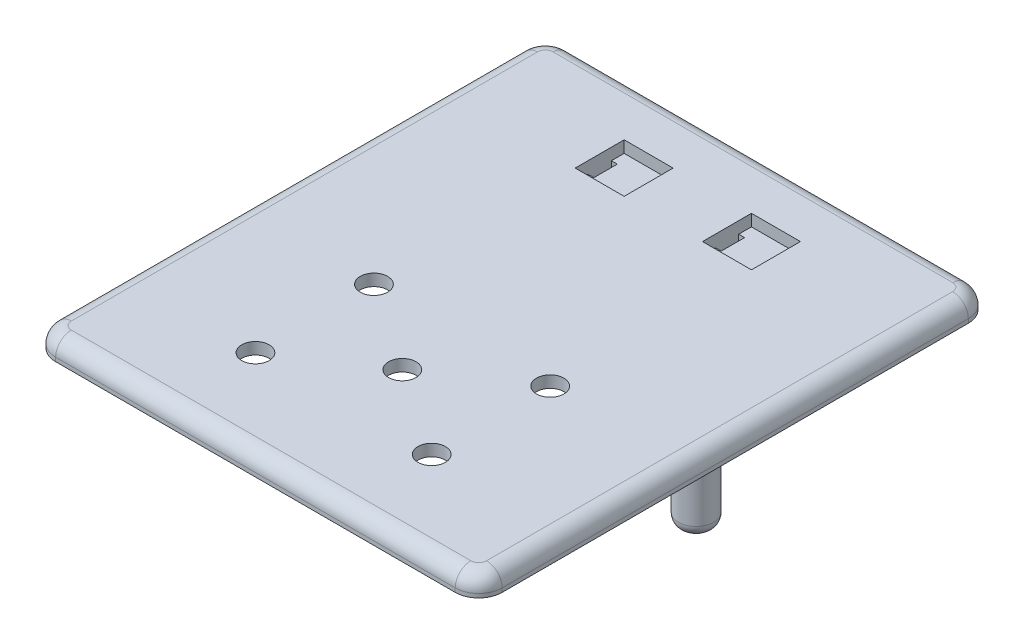
from build123d import *

# Parameters (mm, degrees)
SKETCH1_W             = 114
SKETCH1_H             = 131
BOSS_EXTRUDE1_DEPTH   = 5
SKETCH3_W             = 104
SKETCH3_H             = 121
CUT_EXTRUDE2_DEPTH    = 2
FILLET1_R             = 6
FILLET2_R             = 4
FILLET3_R             = 6
SKETCH5_R             = 7.5
BOSS_EXTRUDE2_DEPTH   = 2
FILLET4_R             = 6
FILLET7_R             = 6
SKETCH15_R            = 4.5
BOSS_EXTRUDE4_DEPTH   = 20
FILLET8_R             = 3
SKETCH10_R            = 3.5
CUT_EXTRUDE3_DEPTH    = 90.102469102
SKETCH11_W            = 22.5
SKETCH11_H            = 22.5
SKETCH11_W_2          = 12.5
SKETCH11_H_2          = 12.5
BOSS_EXTRUDE3_DEPTH   = 8
CUT_EXTRUDE5_START    = -3
SKETCH13_W            = 12.5
SKETCH13_H            = 12.5
CUT_EXTRUDE5_DEPTH    = 94.356239408
SKETCH14_W            = 1.5
SKETCH14_H            = 6
CUT_EXTRUDE6_DEPTH    = 90.572596256
FILLET10_R            = 5
FILLET10_OF_MIRROR1_R = 5
CUT_EXTRUDE7_DEPTH    = 1


with BuildPart() as part:
    # Sketch1 → Boss-Extrude1 (new body)
    with BuildSketch(Plane(origin=(0, 0, 0), x_dir=(1, 0, 0), z_dir=(0, 1, 0))):
        Rectangle(SKETCH1_W, SKETCH1_H)
    extrude(amount=BOSS_EXTRUDE1_DEPTH)

    # Sketch3 → Cut-Extrude2 (cut)
    with BuildSketch(Plane.XZ):
        Rectangle(SKETCH3_W, SKETCH3_H)
    extrude(amount=-CUT_EXTRUDE2_DEPTH, mode=Mode.SUBTRACT)

    # Fillet1
    fillet1_edges = [part.edges().sort_by_distance(p)[0] for p in [
        (57, 2.5, 65.5),
        (-57, 2.5, 65.5),
        (-57, 2.5, -65.5),
        (57, 2.5, -65.5),
    ]]
    fillet(fillet1_edges, radius=FILLET1_R)

    # Fillet2
    fillet2_edges = [part.edges().sort_by_distance(p)[0] for p in [
        (0, 5, 65.5),
        (-57, 5, 0),
        (57, 5, 0),
        (0, 5, -65.5),
        (55.242640687, 5, 63.742640687),
        (55.242640687, 5, -63.742640687),
        (-55.242640687, 5, -63.742640687),
        (-55.242640687, 5, 63.742640687),
    ]]
    fillet(fillet2_edges, radius=FILLET2_R)

    # Fillet3
    fillet3_edges = [part.edges().sort_by_distance(p)[0] for p in [
        (52, 1, -60.5),
        (-52, 1, -60.5),
        (-52, 1, 60.5),
        (52, 1, 60.5),
    ]]
    fillet(fillet3_edges, radius=FILLET3_R)

    # Sketch5 → Boss-Extrude2 (add)
    with BuildSketch(Plane.XZ):
        with Locations((-47, 0)):
            Circle(SKETCH5_R)
        with Locations((47, 0)):
            Circle(SKETCH5_R)
    extrude(amount=-BOSS_EXTRUDE2_DEPTH)

    # Fillet4
    fillet4_edges = [part.edges().sort_by_distance(p)[0] for p in [
        (-52, 1, -5.590169944),
        (-52, 1, 5.590169944),
    ]]
    fillet(fillet4_edges, radius=FILLET4_R)

    # Fillet7
    fillet7_edges = [part.edges().sort_by_distance(p)[0] for p in [
        (52, 1, 5.590169944),
        (52, 1, -5.590169944),
    ]]
    fillet(fillet7_edges, radius=FILLET7_R)

    # Sketch15 → Boss-Extrude4 (add)
    with BuildSketch(Plane.XZ):
        with Locations(Location((-47, 0, 0), (0, 0, 270))):
            Circle(SKETCH15_R)
        with Locations(Location((47, 0, 0), (0, 0, 270))):
            Circle(SKETCH15_R)
    extrude(amount=BOSS_EXTRUDE4_DEPTH)

    # Fillet8
    fillet8_edges = [part.edges().sort_by_distance(p)[0] for p in [
        (-47, -20, 4.5),
        (47, -20, 4.5),
    ]]
    fillet(fillet8_edges, radius=FILLET8_R)

    # Sketch10 → Cut-Extrude3 (cut, through all)
    with BuildSketch(Plane(origin=(0, 0, 0), x_dir=(1, 0, 0), z_dir=(0, 1, 0))):
        with Locations(Location((-22.5, -43, 0), (0, 0, 90))):
            Circle(SKETCH10_R)
        with Locations(Location((22.5, -43, 0), (0, 0, 90))):
            Circle(SKETCH10_R)
        with Locations(Location((22.5, -12.749252692, 0), (0, 0, 90))):
            Circle(SKETCH10_R)
        with Locations(Location((-22.5, -12.749252692, 0), (0, 0, 90))):
            Circle(SKETCH10_R)
        with Locations(Location((0, -28, 0), (0, 0, 90))):
            Circle(SKETCH10_R)
    extrude(amount=CUT_EXTRUDE3_DEPTH, mode=Mode.SUBTRACT)

    # Sketch11 → Boss-Extrude3 (add)
    # profile 1 of 2: a face of its own
    with BuildSketch(Plane(origin=(0, 5, 0), x_dir=(1, 0, 0), z_dir=(0, 1, 0))):
        with Locations((-16.25, 44.883548137)):
            Rectangle(SKETCH11_W, SKETCH11_H)
        with Locations((-16.25, 44.883548137)):
            Rectangle(SKETCH11_W_2, SKETCH11_H_2, mode=Mode.SUBTRACT)
    # profile 2 of 2: a face of its own
    with BuildSketch(Plane(origin=(0, 5, 0), x_dir=(1, 0, 0), z_dir=(0, 1, 0))):
        with Locations((-16.25, 44.883548137)):
            Rectangle(SKETCH11_W_2, SKETCH11_H_2)
    boss_extrude3 = extrude(amount=-BOSS_EXTRUDE3_DEPTH)

    # Sketch13 → Cut-Extrude5 (cut)
    with BuildSketch(Plane(origin=(0, 5, 0), x_dir=(1, 0, 0), z_dir=(0, 1, 0)).offset(CUT_EXTRUDE5_START)):
        with Locations((-16.25, 44.883548137)):
            Rectangle(SKETCH13_W, SKETCH13_H)
    cut_extrude5 = extrude(amount=CUT_EXTRUDE5_DEPTH, mode=Mode.SUBTRACT)

    # Sketch14 → Cut-Extrude6 (cut, symmetric)
    with BuildSketch(Plane(origin=(0, 2, 0), x_dir=(1, 0, 0), z_dir=(0, 1, 0))):
        with Locations((-21.75, 44.883548137)):
            Rectangle(SKETCH14_W, SKETCH14_H)
        with Locations((-10.75, 44.883548137)):
            Rectangle(SKETCH14_W, SKETCH14_H)
    cut_extrude6 = extrude(amount=CUT_EXTRUDE6_DEPTH, both=True, mode=Mode.SUBTRACT)

    # Fillet10
    # the kernel refuses this fillet: 5 mm, written as the material it adds along each edge
    with BuildSketch(Plane(origin=(-27.5, 2, -33.633548137), x_dir=(0, 0, 1), z_dir=(1, 0, 0)), Plane(origin=(-5, 2, -56.133548137), x_dir=(0, 0, -1), z_dir=(-1, 0, 0)), Plane(origin=(-5, 2, -33.633548137), x_dir=(1, 0, 0), z_dir=(0, 0, -1)), Plane(origin=(-27.5, 2, -56.133548137), x_dir=(-1, 0, 0), z_dir=(0, 0, 1))) as fillet10_piece_1:
        with BuildLine():
            CenterArc((FILLET10_R, FILLET10_R), FILLET10_R, 180, 90)
            Line((0, FILLET10_R), (0, 0))
            Line((0, 0), (FILLET10_R, 0))
        make_face()
    extrude(amount=22.5)
    with BuildSketch(Plane(origin=(-40, 2, -33.633548137), x_dir=(0, 0, 1), z_dir=(1, 0, 0))) as fillet10_piece_2a_section:
        with BuildLine():
            CenterArc((FILLET10_R, FILLET10_R), FILLET10_R, 180, 90)
            Line((0, FILLET10_R), (0, 0))
            Line((0, 0), (FILLET10_R, 0))
        make_face()
    fillet10_piece_2a = extrude(amount=35, mode=Mode.PRIVATE)
    fillet10_piece_2a = split(fillet10_piece_2a, bisect_by=Plane(origin=(-27.5, 2, -33.633548137), z_dir=(-1, 0, 0)), keep=Keep.TOP, mode=Mode.PRIVATE)
    with BuildSketch(Plane(origin=(-27.5, 2, -56.133548137), x_dir=(-1, 0, 0), z_dir=(0, 0, 1))) as fillet10_piece_2b_section:
        with BuildLine():
            CenterArc((FILLET10_R, FILLET10_R), FILLET10_R, 180, 90)
            Line((0, FILLET10_R), (0, 0))
            Line((0, 0), (FILLET10_R, 0))
        make_face()
    fillet10_piece_2b = extrude(amount=35, mode=Mode.PRIVATE)
    fillet10_piece_2b = split(fillet10_piece_2b, bisect_by=Plane(origin=(-27.5, 2, -33.633548137), z_dir=(0, 0, 1)), keep=Keep.TOP, mode=Mode.PRIVATE)
    fillet10_piece_2 = fillet10_piece_2a & fillet10_piece_2b
    add(fillet10_piece_2)
    with BuildSketch(Plane(origin=(-5, 2, -21.133548137), x_dir=(1, 0, 0), z_dir=(0, 0, -1))) as fillet10_piece_3a_section:
        with BuildLine():
            CenterArc((FILLET10_R, FILLET10_R), FILLET10_R, 180, 90)
            Line((0, FILLET10_R), (0, 0))
            Line((0, 0), (FILLET10_R, 0))
        make_face()
    fillet10_piece_3a = extrude(amount=35, mode=Mode.PRIVATE)
    fillet10_piece_3a = split(fillet10_piece_3a, bisect_by=Plane(origin=(-5, 2, -33.633548137), z_dir=(0, 0, 1)), keep=Keep.TOP, mode=Mode.PRIVATE)
    with BuildSketch(Plane(origin=(-27.5, 2, -33.633548137), x_dir=(0, 0, 1), z_dir=(1, 0, 0))) as fillet10_piece_3b_section:
        with BuildLine():
            CenterArc((FILLET10_R, FILLET10_R), FILLET10_R, 180, 90)
            Line((0, FILLET10_R), (0, 0))
            Line((0, 0), (FILLET10_R, 0))
        make_face()
    fillet10_piece_3b = extrude(amount=35, mode=Mode.PRIVATE)
    fillet10_piece_3b = split(fillet10_piece_3b, bisect_by=Plane(origin=(-5, 2, -33.633548137), z_dir=(1, 0, 0)), keep=Keep.TOP, mode=Mode.PRIVATE)
    fillet10_piece_3 = fillet10_piece_3a & fillet10_piece_3b
    add(fillet10_piece_3)
    with BuildSketch(Plane(origin=(-5, 2, -33.633548137), x_dir=(1, 0, 0), z_dir=(0, 0, -1))) as fillet10_piece_4a_section:
        with BuildLine():
            CenterArc((FILLET10_R, FILLET10_R), FILLET10_R, 180, 90)
            Line((0, FILLET10_R), (0, 0))
            Line((0, 0), (FILLET10_R, 0))
        make_face()
    fillet10_piece_4a = extrude(amount=35, mode=Mode.PRIVATE)
    fillet10_piece_4a = split(fillet10_piece_4a, bisect_by=Plane(origin=(-5, 2, -56.133548137), z_dir=(0, 0, -1)), keep=Keep.TOP, mode=Mode.PRIVATE)
    with BuildSketch(Plane(origin=(7.5, 2, -56.133548137), x_dir=(0, 0, -1), z_dir=(-1, 0, 0))) as fillet10_piece_4b_section:
        with BuildLine():
            CenterArc((FILLET10_R, FILLET10_R), FILLET10_R, 180, 90)
            Line((0, FILLET10_R), (0, 0))
            Line((0, 0), (FILLET10_R, 0))
        make_face()
    fillet10_piece_4b = extrude(amount=35, mode=Mode.PRIVATE)
    fillet10_piece_4b = split(fillet10_piece_4b, bisect_by=Plane(origin=(-5, 2, -56.133548137), z_dir=(1, 0, 0)), keep=Keep.TOP, mode=Mode.PRIVATE)
    fillet10_piece_4 = fillet10_piece_4a & fillet10_piece_4b
    add(fillet10_piece_4)
    with BuildSketch(Plane(origin=(-27.5, 2, -68.633548137), x_dir=(-1, 0, 0), z_dir=(0, 0, 1))) as fillet10_piece_5a_section:
        with BuildLine():
            CenterArc((FILLET10_R, FILLET10_R), FILLET10_R, 180, 90)
            Line((0, FILLET10_R), (0, 0))
            Line((0, 0), (FILLET10_R, 0))
        make_face()
    fillet10_piece_5a = extrude(amount=35, mode=Mode.PRIVATE)
    fillet10_piece_5a = split(fillet10_piece_5a, bisect_by=Plane(origin=(-27.5, 2, -56.133548137), z_dir=(0, 0, -1)), keep=Keep.TOP, mode=Mode.PRIVATE)
    with BuildSketch(Plane(origin=(-5, 2, -56.133548137), x_dir=(0, 0, -1), z_dir=(-1, 0, 0))) as fillet10_piece_5b_section:
        with BuildLine():
            CenterArc((FILLET10_R, FILLET10_R), FILLET10_R, 180, 90)
            Line((0, FILLET10_R), (0, 0))
            Line((0, 0), (FILLET10_R, 0))
        make_face()
    fillet10_piece_5b = extrude(amount=35, mode=Mode.PRIVATE)
    fillet10_piece_5b = split(fillet10_piece_5b, bisect_by=Plane(origin=(-27.5, 2, -56.133548137), z_dir=(-1, 0, 0)), keep=Keep.TOP, mode=Mode.PRIVATE)
    fillet10_piece_5 = fillet10_piece_5a & fillet10_piece_5b
    add(fillet10_piece_5)

    # Mirror1: Boss-Extrude3, Cut-Extrude5, Cut-Extrude6 across plane
    add(boss_extrude3.mirror(Plane(origin=(0, 0, 0), x_dir=(0, 0, 1), z_dir=(1, 0, 0))))
    add(cut_extrude5.mirror(Plane(origin=(0, 0, 0), x_dir=(0, 0, 1), z_dir=(1, 0, 0))), mode=Mode.SUBTRACT)
    add(cut_extrude6.mirror(Plane(origin=(0, 0, 0), x_dir=(0, 0, 1), z_dir=(1, 0, 0))), mode=Mode.SUBTRACT)

    # Fillet10 of Mirror1
    # the kernel refuses this fillet: 5 mm, written as the material it adds along each edge
    with BuildSketch(Plane(origin=(27.5, 2, -33.633548137), x_dir=(0, 0, 1), z_dir=(-1, 0, 0)), Plane(origin=(5, 2, -56.133548137), x_dir=(0, 0, -1), z_dir=(1, 0, 0)), Plane(origin=(5, 2, -33.633548137), x_dir=(-1, 0, 0), z_dir=(0, 0, -1)), Plane(origin=(27.5, 2, -56.133548137), x_dir=(1, 0, 0), z_dir=(0, 0, 1))) as fillet10_of_mirror1_piece_1:
        with BuildLine():
            CenterArc((FILLET10_OF_MIRROR1_R, -FILLET10_OF_MIRROR1_R), FILLET10_OF_MIRROR1_R, 90, 90)
            Line((0, -FILLET10_OF_MIRROR1_R), (0, 0))
            Line((0, 0), (FILLET10_OF_MIRROR1_R, 0))
        make_face()
    extrude(amount=22.5)
    with BuildSketch(Plane(origin=(27.5, 2, -56.133548137), x_dir=(1, 0, 0), z_dir=(0, 0, 1))) as fillet10_of_mirror1_piece_2a_section:
        with BuildLine():
            CenterArc((FILLET10_OF_MIRROR1_R, -FILLET10_OF_MIRROR1_R), FILLET10_OF_MIRROR1_R, 90, 90)
            Line((0, -FILLET10_OF_MIRROR1_R), (0, 0))
            Line((0, 0), (FILLET10_OF_MIRROR1_R, 0))
        make_face()
    fillet10_of_mirror1_piece_2a = extrude(amount=35, mode=Mode.PRIVATE)
    fillet10_of_mirror1_piece_2a = split(fillet10_of_mirror1_piece_2a, bisect_by=Plane(origin=(27.5, 2, -33.633548137), z_dir=(0, 0, 1)), keep=Keep.TOP, mode=Mode.PRIVATE)
    with BuildSketch(Plane(origin=(40, 2, -33.633548137), x_dir=(0, 0, 1), z_dir=(-1, 0, 0))) as fillet10_of_mirror1_piece_2b_section:
        with BuildLine():
            CenterArc((FILLET10_OF_MIRROR1_R, -FILLET10_OF_MIRROR1_R), FILLET10_OF_MIRROR1_R, 90, 90)
            Line((0, -FILLET10_OF_MIRROR1_R), (0, 0))
            Line((0, 0), (FILLET10_OF_MIRROR1_R, 0))
        make_face()
    fillet10_of_mirror1_piece_2b = extrude(amount=35, mode=Mode.PRIVATE)
    fillet10_of_mirror1_piece_2b = split(fillet10_of_mirror1_piece_2b, bisect_by=Plane(origin=(27.5, 2, -33.633548137), z_dir=(1, 0, 0)), keep=Keep.TOP, mode=Mode.PRIVATE)
    fillet10_of_mirror1_piece_2 = fillet10_of_mirror1_piece_2a & fillet10_of_mirror1_piece_2b
    add(fillet10_of_mirror1_piece_2)
    with BuildSketch(Plane(origin=(27.5, 2, -33.633548137), x_dir=(0, 0, 1), z_dir=(-1, 0, 0))) as fillet10_of_mirror1_piece_3a_section:
        with BuildLine():
            CenterArc((FILLET10_OF_MIRROR1_R, -FILLET10_OF_MIRROR1_R), FILLET10_OF_MIRROR1_R, 90, 90)
            Line((0, -FILLET10_OF_MIRROR1_R), (0, 0))
            Line((0, 0), (FILLET10_OF_MIRROR1_R, 0))
        make_face()
    fillet10_of_mirror1_piece_3a = extrude(amount=35, mode=Mode.PRIVATE)
    fillet10_of_mirror1_piece_3a = split(fillet10_of_mirror1_piece_3a, bisect_by=Plane(origin=(5, 2, -33.633548137), z_dir=(-1, 0, 0)), keep=Keep.TOP, mode=Mode.PRIVATE)
    with BuildSketch(Plane(origin=(5, 2, -21.133548137), x_dir=(-1, 0, 0), z_dir=(0, 0, -1))) as fillet10_of_mirror1_piece_3b_section:
        with BuildLine():
            CenterArc((FILLET10_OF_MIRROR1_R, -FILLET10_OF_MIRROR1_R), FILLET10_OF_MIRROR1_R, 90, 90)
            Line((0, -FILLET10_OF_MIRROR1_R), (0, 0))
            Line((0, 0), (FILLET10_OF_MIRROR1_R, 0))
        make_face()
    fillet10_of_mirror1_piece_3b = extrude(amount=35, mode=Mode.PRIVATE)
    fillet10_of_mirror1_piece_3b = split(fillet10_of_mirror1_piece_3b, bisect_by=Plane(origin=(5, 2, -33.633548137), z_dir=(0, 0, 1)), keep=Keep.TOP, mode=Mode.PRIVATE)
    fillet10_of_mirror1_piece_3 = fillet10_of_mirror1_piece_3a & fillet10_of_mirror1_piece_3b
    add(fillet10_of_mirror1_piece_3)
    with BuildSketch(Plane(origin=(-7.5, 2, -56.133548137), x_dir=(0, 0, -1), z_dir=(1, 0, 0))) as fillet10_of_mirror1_piece_4a_section:
        with BuildLine():
            CenterArc((FILLET10_OF_MIRROR1_R, -FILLET10_OF_MIRROR1_R), FILLET10_OF_MIRROR1_R, 90, 90)
            Line((0, -FILLET10_OF_MIRROR1_R), (0, 0))
            Line((0, 0), (FILLET10_OF_MIRROR1_R, 0))
        make_face()
    fillet10_of_mirror1_piece_4a = extrude(amount=35, mode=Mode.PRIVATE)
    fillet10_of_mirror1_piece_4a = split(fillet10_of_mirror1_piece_4a, bisect_by=Plane(origin=(5, 2, -56.133548137), z_dir=(-1, 0, 0)), keep=Keep.TOP, mode=Mode.PRIVATE)
    with BuildSketch(Plane(origin=(5, 2, -33.633548137), x_dir=(-1, 0, 0), z_dir=(0, 0, -1))) as fillet10_of_mirror1_piece_4b_section:
        with BuildLine():
            CenterArc((FILLET10_OF_MIRROR1_R, -FILLET10_OF_MIRROR1_R), FILLET10_OF_MIRROR1_R, 90, 90)
            Line((0, -FILLET10_OF_MIRROR1_R), (0, 0))
            Line((0, 0), (FILLET10_OF_MIRROR1_R, 0))
        make_face()
    fillet10_of_mirror1_piece_4b = extrude(amount=35, mode=Mode.PRIVATE)
    fillet10_of_mirror1_piece_4b = split(fillet10_of_mirror1_piece_4b, bisect_by=Plane(origin=(5, 2, -56.133548137), z_dir=(0, 0, -1)), keep=Keep.TOP, mode=Mode.PRIVATE)
    fillet10_of_mirror1_piece_4 = fillet10_of_mirror1_piece_4a & fillet10_of_mirror1_piece_4b
    add(fillet10_of_mirror1_piece_4)
    with BuildSketch(Plane(origin=(5, 2, -56.133548137), x_dir=(0, 0, -1), z_dir=(1, 0, 0))) as fillet10_of_mirror1_piece_5a_section:
        with BuildLine():
            CenterArc((FILLET10_OF_MIRROR1_R, -FILLET10_OF_MIRROR1_R), FILLET10_OF_MIRROR1_R, 90, 90)
            Line((0, -FILLET10_OF_MIRROR1_R), (0, 0))
            Line((0, 0), (FILLET10_OF_MIRROR1_R, 0))
        make_face()
    fillet10_of_mirror1_piece_5a = extrude(amount=35, mode=Mode.PRIVATE)
    fillet10_of_mirror1_piece_5a = split(fillet10_of_mirror1_piece_5a, bisect_by=Plane(origin=(27.5, 2, -56.133548137), z_dir=(1, 0, 0)), keep=Keep.TOP, mode=Mode.PRIVATE)
    with BuildSketch(Plane(origin=(27.5, 2, -68.633548137), x_dir=(1, 0, 0), z_dir=(0, 0, 1))) as fillet10_of_mirror1_piece_5b_section:
        with BuildLine():
            CenterArc((FILLET10_OF_MIRROR1_R, -FILLET10_OF_MIRROR1_R), FILLET10_OF_MIRROR1_R, 90, 90)
            Line((0, -FILLET10_OF_MIRROR1_R), (0, 0))
            Line((0, 0), (FILLET10_OF_MIRROR1_R, 0))
        make_face()
    fillet10_of_mirror1_piece_5b = extrude(amount=35, mode=Mode.PRIVATE)
    fillet10_of_mirror1_piece_5b = split(fillet10_of_mirror1_piece_5b, bisect_by=Plane(origin=(27.5, 2, -56.133548137), z_dir=(0, 0, -1)), keep=Keep.TOP, mode=Mode.PRIVATE)
    fillet10_of_mirror1_piece_5 = fillet10_of_mirror1_piece_5a & fillet10_of_mirror1_piece_5b
    add(fillet10_of_mirror1_piece_5)

    # Sketch16 → Cut-Extrude7 (cut)
    with BuildSketch(Plane.XZ.offset(-2)):
        Polygon((0, 0), (0, -11.879719733), (6.193565843, -5.68615389), (11.879719733, -11.372307779), (11.879719733, 0), align=None)
        Polygon((-6.193565843, -5.68615389), (0, -11.879719733), (0, 0), (-11.879719733, 0), (-11.879719733, -11.372307779), align=None)
    extrude(amount=-CUT_EXTRUDE7_DEPTH, mode=Mode.SUBTRACT)


solid = part.part
